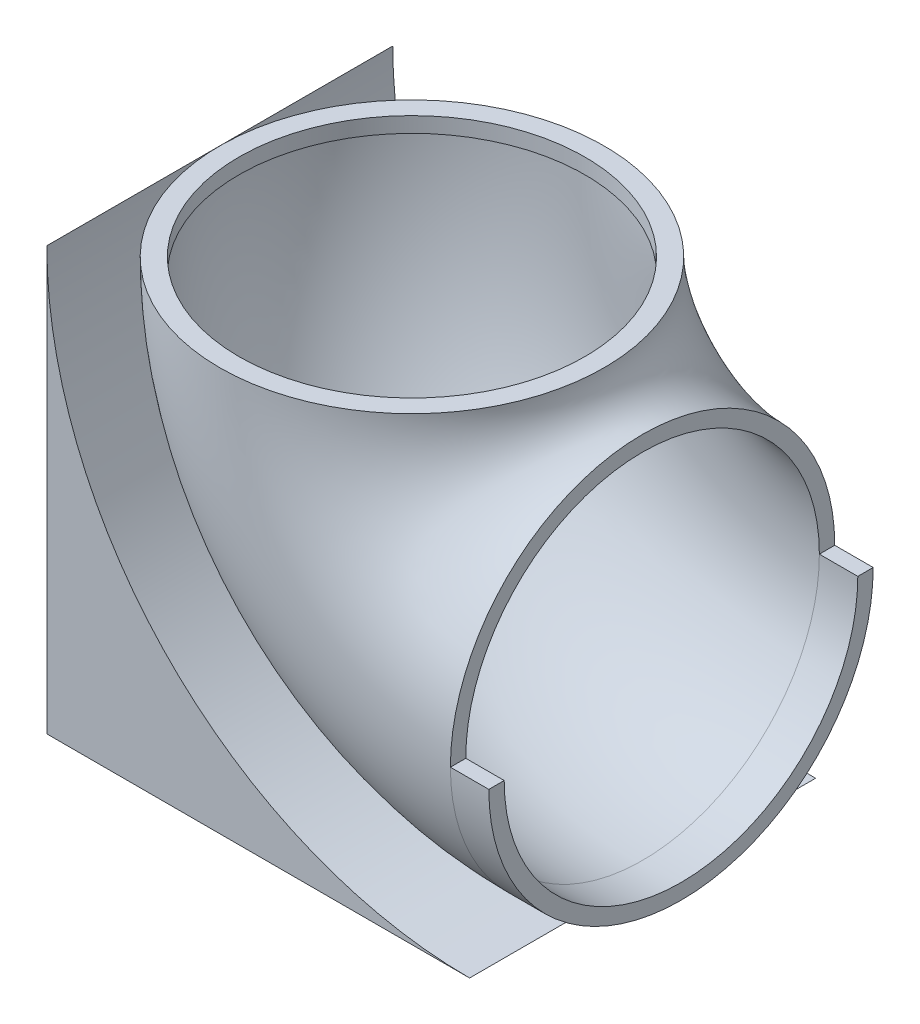
from build123d import *

# Parameters (mm, degrees)
SKETCH2_R               = 25
SKETCH2_R_2             = 22.5
BOSS_EXTRUDE1_DEPTH     = 85
SKETCH3_R               = 25
REVOLVE1_ANGLE          = 90
SKETCH4_R               = 25
BOSS_EXTRUDE2_DEPTH     = 5
VACIADO1_T              = -2
CORTAR_EXTRUIR1_DEPTH   = 5
SALIENTE_EXTRUIR2_DEPTH = 22.5
CROQUIS3_R              = 4
CORTAR_EXTRUIR2_DEPTH   = 6
CORTAR_EXTRUIR3_START   = -2
CROQUIS4_R              = 22.5
CORTAR_EXTRUIR3_DEPTH   = 2
CROQUIS7_W              = 63.146110897
CROQUIS7_H              = 56.407197876
CORTAR_EXTRUIR6_DEPTH   = 85


with BuildPart() as part:
    # Sketch2 → Boss-Extrude1 (new body)
    with BuildSketch(Plane(origin=(0, 0, 0), x_dir=(1, 0, 0), z_dir=(0, 1, 0))):
        Circle(SKETCH2_R)
        Circle(SKETCH2_R_2, mode=Mode.SUBTRACT)
    extrude(amount=BOSS_EXTRUDE1_DEPTH)

    # Sketch3 → Revolve1 (revolve)
    with BuildSketch(Plane(origin=(0, 0, 0), x_dir=(1, 0, 0), z_dir=(0, 1, 0))):
        Circle(SKETCH3_R)
    revolve(axis=Axis((30, 0, -21.726770061), (0, 0, 1)), revolution_arc=REVOLVE1_ANGLE)

    # Sketch4 → Boss-Extrude2 (add)
    with BuildSketch(Plane(origin=(30, 0, 0), x_dir=(0, 0, -1), z_dir=(1, 0, 0))):
        with Locations((0, -30)):
            Circle(SKETCH4_R)
    extrude(amount=BOSS_EXTRUDE2_DEPTH)

    # Vaciado1
    vaciado1_openings = [part.faces().sort_by_distance(p)[0] for p in [
        (35, -30, 0),
    ]]
    offset(amount=VACIADO1_T, openings=vaciado1_openings, kind=Kind.INTERSECTION)

    # Croquis1 → Cortar-Extruir1 (cut)
    with BuildSketch(Plane(origin=(35, 0, 0), x_dir=(0, 0, -1), z_dir=(1, 0, 0))):
        with BuildLine():
            Line((-25, -30), (25, -30))
            ThreePointArc((25, -30), (0, 0.962643483), (-25, -30))
        make_face()
    extrude(amount=-CORTAR_EXTRUIR1_DEPTH, mode=Mode.SUBTRACT)

    # Croquis4 → Cortar-Extruir3 (cut)
    with BuildSketch(Plane(origin=(0, 0, 0), x_dir=(1, 0, 0), z_dir=(0, 1, 0)).offset(CORTAR_EXTRUIR3_START)):
        Circle(CROQUIS4_R)
    extrude(amount=CORTAR_EXTRUIR3_DEPTH, mode=Mode.SUBTRACT)

    # Croquis7 → Cortar-Extruir6 (cut)
    with BuildSketch(Plane(origin=(0, 85, 0), x_dir=(1, 0, 0), z_dir=(0, 1, 0))):
        with Locations((-5.152955543, -1.701615566)):
            Rectangle(CROQUIS7_W, CROQUIS7_H)
    extrude(amount=-CORTAR_EXTRUIR6_DEPTH, mode=Mode.SUBTRACT)


with BuildPart() as body_2:
    # Croquis3D2 → Saliente-Extruir2 (new, symmetric)
    with BuildSketch(Plane(origin=(-25, 0, 0), x_dir=(0.7071067811865489, -0.7071067811865462, 0), z_dir=(0, 0, -1))):
        with BuildLine():
            Line((0, 0), (38.890872965, 38.890872965))
            Line((38.890872965, 38.890872965), (77.781745931, 0))
            ThreePointArc((77.781745931, 0), (38.890872965, 16.109127035), (0, 0))
        make_face()
    extrude(amount=SALIENTE_EXTRUIR2_DEPTH, both=True)

    # Croquis3 → Cortar-Extruir2 (cut)
    with BuildSketch(Plane(origin=(0, -55, 0), x_dir=(-1, 0, 0), z_dir=(0, -1, 0))):
        with Locations((10, -15)):
            Circle(CROQUIS3_R)
        with Locations((10, 15)):
            Circle(CROQUIS3_R)
    extrude(amount=-CORTAR_EXTRUIR2_DEPTH, mode=Mode.SUBTRACT)


solid = Compound([part.part, body_2.part])
